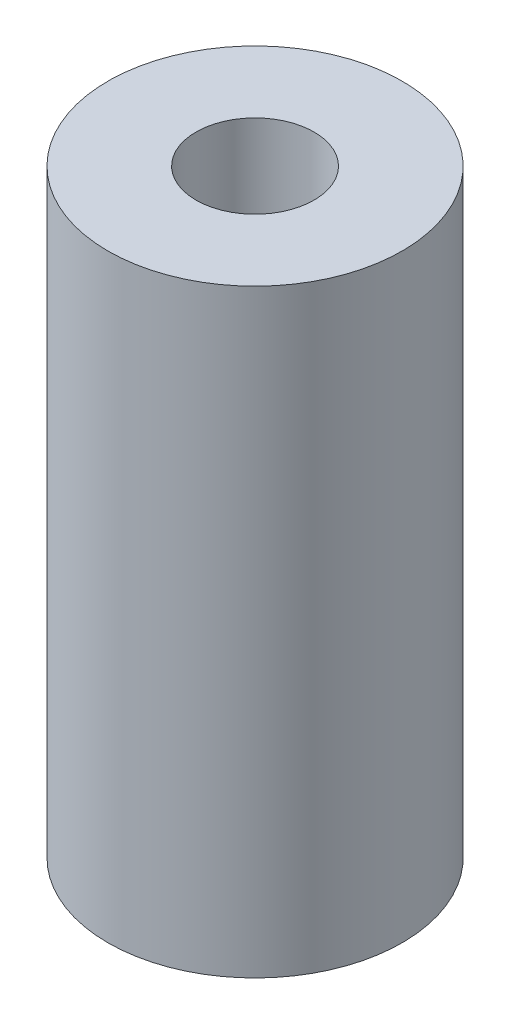
from build123d import *

# Parameters (mm, degrees)
SKETCH1_R                = 8.35
SKETCH1_R_2              = 3.35
BOSS_EXTRUDE1_DEPTH      = 34
BOSS_EXTRUDE2_DEPTH      = 0.5
BOSS_EXTRUDE2_DEPTH_BACK = 0.5
SKETCH2_R                = 3.35
SKETCH2_R_2              = 2.35
CHAMFER1_SIZE            = 1


with BuildPart() as part:
    # Sketch1 → Boss-Extrude1 (new body)
    with BuildSketch(Plane(origin=(0, 0, 0), x_dir=(1, 0, 0), z_dir=(0, 1, 0))):
        with Locations(Location((0, 0, 0), (0, 0, 270))):
            Circle(SKETCH1_R)
        with Locations(Location((0, 0, 0), (0, 0, 270))):
            Circle(SKETCH1_R_2, mode=Mode.SUBTRACT)
    extrude(amount=BOSS_EXTRUDE1_DEPTH)

    # Sketch2 → Boss-Extrude2 (add, two sides: drawn at the far end of the back side and taken through both)
    with BuildSketch(Plane(origin=(0, 17, 0), x_dir=(1, 0, 0), z_dir=(0, 1, 0)).offset(-BOSS_EXTRUDE2_DEPTH_BACK)):
        with Locations(Location((0, 0, 0), (0, 0, 270))):
            Circle(SKETCH2_R)
        with Locations(Location((0, 0, 0), (0, 0, 270))):
            Circle(SKETCH2_R_2, mode=Mode.SUBTRACT)
    extrude(amount=BOSS_EXTRUDE2_DEPTH + BOSS_EXTRUDE2_DEPTH_BACK)

    # Chamfer1
    chamfer1_edges = [part.edges().sort_by_distance(p)[0] for p in [
        (0, 17.5, -3.35),
        (0, 16.5, -3.35),
    ]]
    chamfer(chamfer1_edges, length=CHAMFER1_SIZE - 0.0001)  # a hair under: the kernel refuses the full size


solid = part.part
